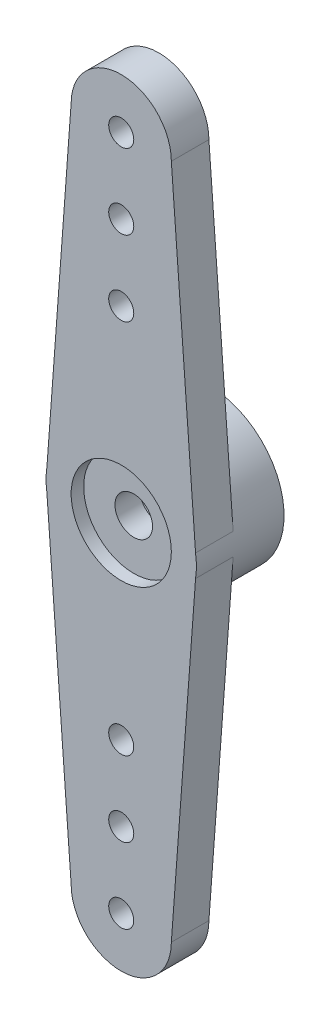
from build123d import *

# Parameters (mm, degrees)
BOSS_EXTRU_2_DEPTH         = 1.5
BOSS_EXTRU_3_START         = 2
ESQUISSE2_R                = 3
ESQUISSE2_R_2              = 2
BOSS_EXTRU_3_DEPTH         = 2
ESQUISSE3_R                = 0.75
ENL_V_MAT_EXTRU_1_DEPTH    = 2
ENL_V_START                = -0.5
ESQUISSE4_R                = 2
ENL_V_MAT_EXTRU_2_DEPTH    = 0.5
ESQUISSE5_R                = 0.5
ENL_V_MAT_EXTRU_3_DEPTH    = 17.170961629
R_P_TITION_LIN_AIRE1_COUNT = 3
R_P_TITION_LIN_AIRE1_PITCH = 3
SYM_TRIE1_COPY_1_SKETCH_R  = 0.5
SYM_TRIE1_COPY_1_DEPTH     = 17.170961629
SYM_TRIE1_COPY_2_SKETCH_R  = 0.5
SYM_TRIE1_COPY_2_DEPTH     = 17.170961629
SYM_TRIE1_COPY_3_SKETCH_R  = 0.5
SYM_TRIE1_COPY_3_DEPTH     = 17.170961629


with BuildPart() as part:
    # Esquisse1 → Boss.-Extru.2 (new body)
    with BuildSketch(Plane.XY):
        with BuildLine():
            Line((2, 13.5), (2.967257844, 0.4420191))
            ThreePointArc((2.967257844, 0.4420191), (3, 0), (2.967257844, -0.4420191))
            Line((2.967257844, -0.4420191), (2, -13.5))
            ThreePointArc((2, -13.5), (0, -15.5), (-2, -13.5))
            Line((-2, -13.5), (-2.967257844, -0.4420191))
            ThreePointArc((-2.967257844, -0.4420191), (-3, 0), (-2.967257844, 0.4420191))
            Line((-2.967257844, 0.4420191), (-2, 13.5))
            ThreePointArc((-2, 13.5), (0, 15.5), (2, 13.5))
        make_face()
    extrude(amount=BOSS_EXTRU_2_DEPTH)

    # Esquisse2 → Boss.-Extru.3 (add)
    with BuildSketch(Plane(origin=(0, 0, 0), x_dir=(-1, 0, 0), z_dir=(0, 0, -1)).offset(BOSS_EXTRU_3_START)):
        Circle(ESQUISSE2_R)
        Circle(ESQUISSE2_R_2, mode=Mode.SUBTRACT)
    extrude(amount=-BOSS_EXTRU_3_DEPTH)

    # Esquisse3 → Enlèv. mat.-Extru.1 (cut)
    with BuildSketch(Plane(origin=(0, 0, 0), x_dir=(-1, 0, 0), z_dir=(0, 0, -1))):
        Circle(ESQUISSE3_R)
    extrude(amount=-ENL_V_MAT_EXTRU_1_DEPTH, mode=Mode.SUBTRACT)

    # Esquisse4 → Enlèv. mat.-Extru.2 (cut)
    with BuildSketch(Plane.XY.offset(1.5).offset(ENL_V_START)):
        Circle(ESQUISSE4_R)
    extrude(amount=ENL_V_MAT_EXTRU_2_DEPTH, mode=Mode.SUBTRACT)

    # Esquisse5 → Enlèv. mat.-Extru.3 (cut, through all)
    with BuildSketch(Plane.XY.offset(1.5)):
        with Locations((0, 13.5)):
            Circle(ESQUISSE5_R)
    enl_v_mat_extru_3 = extrude(amount=-ENL_V_MAT_EXTRU_3_DEPTH, mode=Mode.SUBTRACT)

    # Répétition linéaire1: Enlèv. mat.-Extru.3 ×3
    with Locations(*[(0, -i * R_P_TITION_LIN_AIRE1_PITCH, 0) for i in range(1, R_P_TITION_LIN_AIRE1_COUNT)]):
        add(enl_v_mat_extru_3, mode=Mode.SUBTRACT)

    # Symétrie1 copy 1 sketch → Symétrie1 copy 1 (cut, through all)
    with BuildSketch(Plane(origin=(0, 3, 1.5), x_dir=(1, 0, 0), z_dir=(0, 0, 1))):
        with Locations((0, -13.5)):
            Circle(SYM_TRIE1_COPY_1_SKETCH_R)
    extrude(amount=-SYM_TRIE1_COPY_1_DEPTH, mode=Mode.SUBTRACT)

    # Symétrie1 copy 2 sketch → Symétrie1 copy 2 (cut, through all)
    with BuildSketch(Plane(origin=(0, 6, 1.5), x_dir=(1, 0, 0), z_dir=(0, 0, 1))):
        with Locations((0, -13.5)):
            Circle(SYM_TRIE1_COPY_2_SKETCH_R)
    extrude(amount=-SYM_TRIE1_COPY_2_DEPTH, mode=Mode.SUBTRACT)

    # Symétrie1 copy 3 sketch → Symétrie1 copy 3 (cut, through all)
    with BuildSketch(Plane.XY.offset(1.5)):
        with Locations((0, -13.5)):
            Circle(SYM_TRIE1_COPY_3_SKETCH_R)
    extrude(amount=-SYM_TRIE1_COPY_3_DEPTH, mode=Mode.SUBTRACT)


solid = part.part
